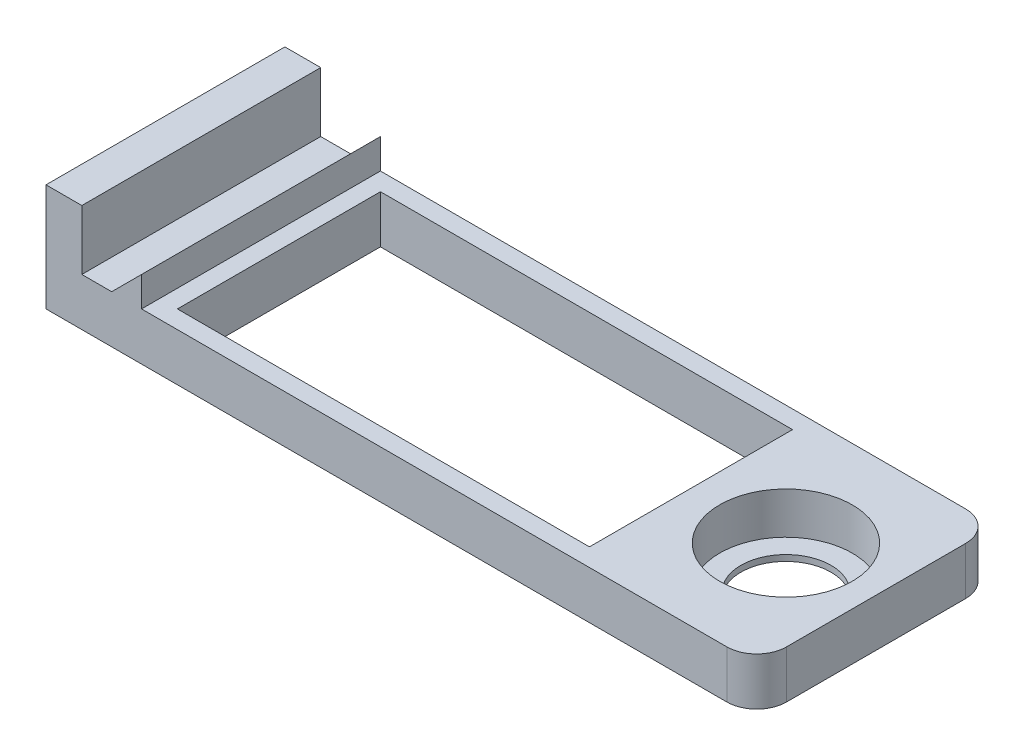
from build123d import *

# Parameters (mm, degrees)
SKETCH1_W           = 119
SKETCH1_H           = 40
BOSS_EXTRUDE1_DEPTH = 8
SKETCH2_R           = 11.1
CUT_EXTRUDE1_DEPTH  = 7
CUT_EXTRUDE2_REACH  = 65.279
SKETCH3_R           = 7.55
SKETCH4_W           = 6
SKETCH4_H           = 40
BOSS_EXTRUDE2_DEPTH = 10
BOSS_EXTRUDE3_DEPTH = 40
FILLET1_R           = 5
CUT_EXTRUDE3_REACH  = 65.563
SKETCH7_W           = 69
SKETCH7_H           = 34


with BuildPart() as part:
    # Sketch1 → Boss-Extrude1 (new body)
    with BuildSketch(Plane(origin=(0, 0, 0), x_dir=(1, 0, 0), z_dir=(0, 1, 0))):
        Rectangle(SKETCH1_W, SKETCH1_H)
    extrude(amount=BOSS_EXTRUDE1_DEPTH)

    # Sketch2 → Cut-Extrude1 (cut)
    with BuildSketch(Plane(origin=(0, 8, 0), x_dir=(1, 0, 0), z_dir=(0, 1, 0))):
        with Locations((44.4, 0)):
            Circle(SKETCH2_R)
    extrude(amount=-CUT_EXTRUDE1_DEPTH, mode=Mode.SUBTRACT)

    # Sketch3 → Cut-Extrude2 (cut, up to next)
    with BuildSketch(Plane.XZ, mode=Mode.PRIVATE) as cut_extrude2_sk1:
        with Locations((44.4, 0)):
            Circle(SKETCH3_R)
    cut_extrude2_tool1 = extrude(cut_extrude2_sk1.sketch, amount=-CUT_EXTRUDE2_REACH, mode=Mode.PRIVATE) & part.part
    add(cut_extrude2_tool1.solids().sort_by_distance((44.4, 0, 0))[0], mode=Mode.SUBTRACT)

    # Sketch4 → Boss-Extrude2 (add)
    with BuildSketch(Plane(origin=(0, 8, 0), x_dir=(1, 0, 0), z_dir=(0, 1, 0))):
        with Locations((-56.5, 0)):
            Rectangle(SKETCH4_W, SKETCH4_H)
    extrude(amount=BOSS_EXTRUDE2_DEPTH)

    # Sketch6 → Boss-Extrude3 (add)
    with BuildSketch(Plane.XY.offset(20)):
        Polygon((-43.5, 8), (-43.5, 13), (-48.5, 8), align=None)
    extrude(amount=-BOSS_EXTRUDE3_DEPTH)

    # Fillet1
    fillet1_edges = [part.edges().sort_by_distance(p)[0] for p in [
        (59.5, 4, 20),
        (59.5, 4, -20),
    ]]
    fillet(fillet1_edges, radius=FILLET1_R)

    # Sketch7 → Cut-Extrude3 (cut, up to next)
    with BuildSketch(Plane(origin=(0, 8, 0), x_dir=(1, 0, 0), z_dir=(0, 1, 0)), mode=Mode.PRIVATE) as cut_extrude3_sk1:
        with Locations((-6, 0)):
            Rectangle(SKETCH7_W, SKETCH7_H)
    cut_extrude3_tool1 = extrude(cut_extrude3_sk1.sketch, amount=-CUT_EXTRUDE3_REACH, mode=Mode.PRIVATE) & part.part
    add(cut_extrude3_tool1.solids().sort_by_distance((-6, 8, 0))[0], mode=Mode.SUBTRACT)


solid = part.part
